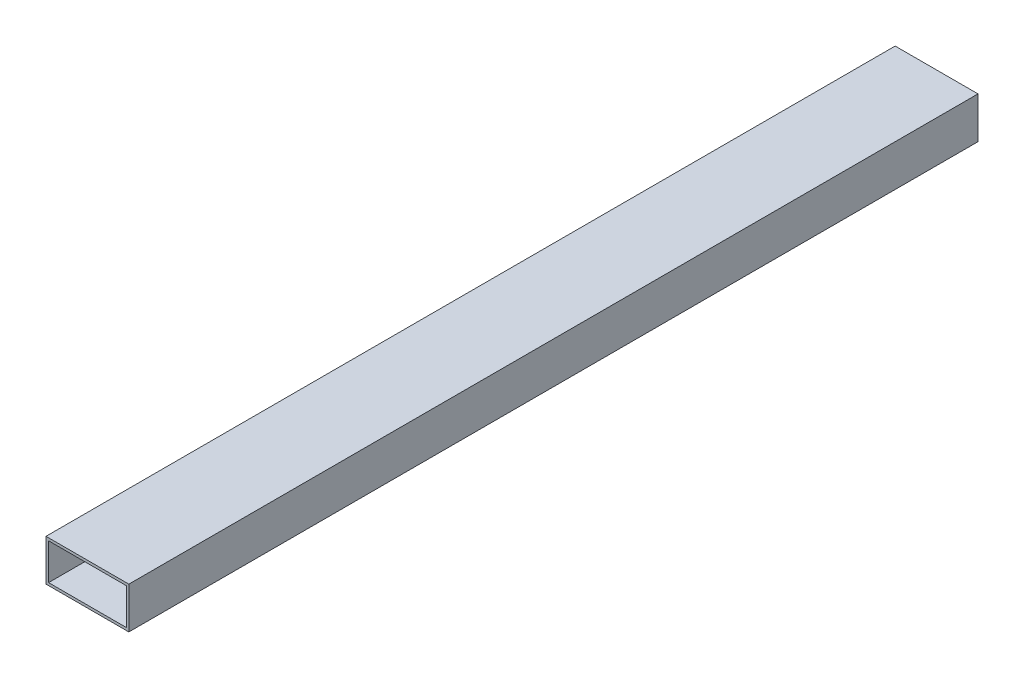
from build123d import *

# Parameters (mm, degrees)
SKETCH1_W           = 50.8
SKETCH1_H           = 25.4
SKETCH1_W_2         = 47.625
SKETCH1_H_2         = 22.225
BOSS_EXTRUDE1_DEPTH = 260.35


with BuildPart() as part:
    # Sketch1 → Boss-Extrude1 (new, symmetric)
    with BuildSketch(Plane.XY):
        Rectangle(SKETCH1_W, SKETCH1_H)
        Rectangle(SKETCH1_W_2, SKETCH1_H_2, mode=Mode.SUBTRACT)
    extrude(amount=BOSS_EXTRUDE1_DEPTH, both=True)


solid = part.part
